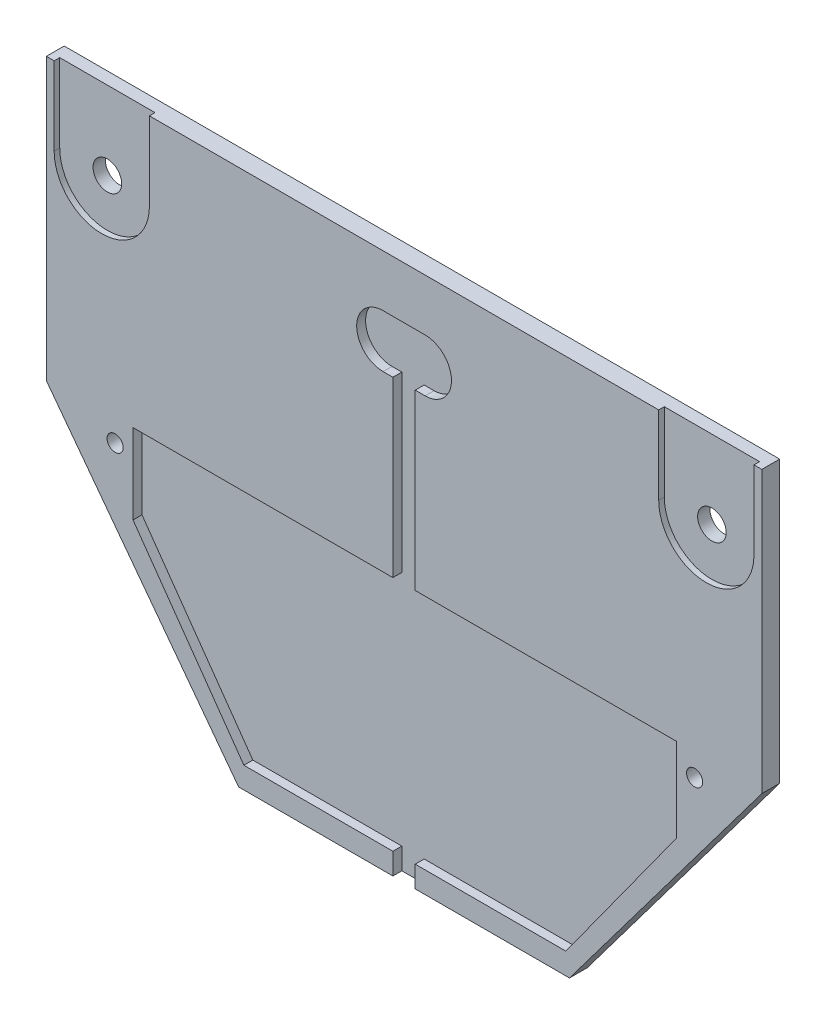
from build123d import *

# Parameters (mm, degrees)
BASE_FLANGE1_DEPTH        = 5.08
TAIL_CONNECTION_DEPTH     = 2.54
SKETCH4_R                 = 4.064
TAB_BOLT_HOLES_DEPTH      = 184.232438176
BATTERY_CUTOUT_DEPTH      = 2.54
SKETCH6_W                 = 6.35
SKETCH6_H                 = 49.280438222
TOP_WIRE_CONNECTION_DEPTH = 2.54
SKETCH7_W                 = 6.35
SKETCH7_H                 = 6.091561778
BOTTOM_WIRES_DEPTH        = 2.54
SKETCH8_R                 = 2.286
BOTTOM_BOLTS_DEPTH        = 184.232438176
CUT_EXTRUDE10_DEPTH       = 1.5875


# Sheet-metal steps are written as plain solids
with BuildPart() as part:
    # Sketch1 → Base-Flange1 (new body)
    with BuildSketch(Plane.XY):
        Polygon((0, 0), (46.99, 0), (101.6, 72.644), (101.6, 152.4), (-101.6, 152.4), (-101.6, 72.644), (-46.99, 0), align=None)
    extrude(amount=-BASE_FLANGE1_DEPTH)

    # Sketch2 → Tail Connection (cut)
    with BuildSketch(Plane.XY):
        with BuildLine():
            Line((-5.969, 137.668), (5.969, 137.668))
            ThreePointArc((5.969, 137.668), (13.462, 130.175), (5.969, 122.682))
            Line((5.969, 122.682), (-5.969, 122.682))
            ThreePointArc((-5.969, 122.682), (-13.462, 130.175), (-5.969, 137.668))
        make_face()
    extrude(amount=-TAIL_CONNECTION_DEPTH, mode=Mode.SUBTRACT)

    # Sketch4 → Tab Bolt Holes (cut, through all)
    with BuildSketch(Plane.XY):
        with Locations((-85.852, 130.175)):
            Circle(SKETCH4_R)
        with Locations((85.852, 130.175)):
            Circle(SKETCH4_R)
    extrude(amount=-TAB_BOLT_HOLES_DEPTH, mode=Mode.SUBTRACT)

    # Sketch5 → Battery Cutout (cut)
    with BuildSketch(Plane.XY):
        Polygon((-76.973649394, 50.672541858), (-76.973649394, 73.401561778), (77.43879929, 73.401561778), (77.43879929, 49.679437927), (45.952574948, 6.091561778), (-45.487425052, 6.091561778), align=None)
    extrude(amount=-BATTERY_CUTOUT_DEPTH, mode=Mode.SUBTRACT)

    # Sketch6 → Top Wire Connection (cut)
    with BuildSketch(Plane.XY):
        with Locations((0, 98.041780889)):
            Rectangle(SKETCH6_W, SKETCH6_H)
    extrude(amount=-TOP_WIRE_CONNECTION_DEPTH, mode=Mode.SUBTRACT)

    # Sketch7 → Bottom Wires (cut)
    with BuildSketch(Plane.XY):
        with Locations((0, 3.045780889)):
            Rectangle(SKETCH7_W, SKETCH7_H)
    extrude(amount=-BOTTOM_WIRES_DEPTH, mode=Mode.SUBTRACT)

    # Sketch8 → Bottom Bolts (cut, through all)
    with BuildSketch(Plane.XY):
        with Locations((-82.053649394, 67.056)):
            Circle(SKETCH8_R)
        with Locations((82.51879929, 67.056)):
            Circle(SKETCH8_R)
    extrude(amount=-BOTTOM_BOLTS_DEPTH, mode=Mode.SUBTRACT)

    # Sketch9 → Cut-Extrude10 (cut)
    with BuildSketch(Plane.XY):
        with BuildLine():
            Line((72.3265, 152.4), (72.3265, 130.175))
            ThreePointArc((72.3265, 130.175), (85.852, 116.6495), (99.3775, 130.175))
            Line((99.3775, 130.175), (99.3775, 152.4))
            Line((99.3775, 152.4), (72.3265, 152.4))
        make_face()
    cut_extrude10 = extrude(amount=-CUT_EXTRUDE10_DEPTH, mode=Mode.SUBTRACT)

    # Mirror1: Cut-Extrude10 across plane
    add(cut_extrude10.mirror(Plane(origin=(0, 0, 0), x_dir=(0, 0, 1), z_dir=(1, 0, 0))), mode=Mode.SUBTRACT)


solid = part.part
